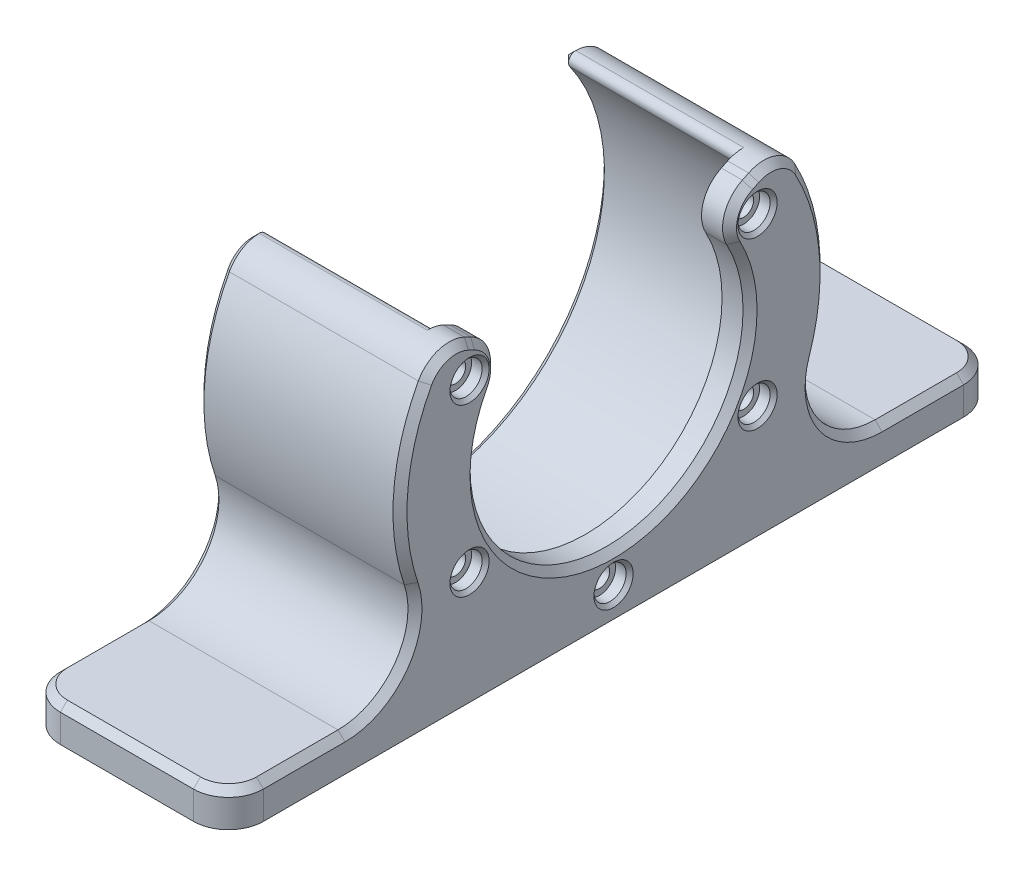
from build123d import *

# Parameters (mm, degrees)
SKETCH1_R           = 1.45
BOSS_EXTRUDE1_DEPTH = 29
FILLET1_R           = 10
FILLET2_R           = 5
SKETCH2_R           = 26.7
CUT_EXTRUDE1_DEPTH  = 25
FILLET3_R           = 1
FILLET4_R           = 5
SKETCH3_R           = 2.3
CUT_EXTRUDE2_DEPTH  = 2
CHAMFER2_SIZE       = 0.5


with BuildPart() as part:
    # Sketch1 → Boss-Extrude1 (new body)
    with BuildSketch(Plane(origin=(0, 0, 0), x_dir=(0, 0, -1), z_dir=(1, 0, 0))):
        with BuildLine():
            Line((55, 0), (-55, 0))
            Line((-55, 0), (-55, 5))
            Line((-55, 5), (-20.031225624, 5))
            ThreePointArc((-20.031225624, 5), (-30.341828635, 24.897833805), (-24.271193132, 46.470494957))
            Line((-24.271193132, 46.470494957), (-14.03683849, 41.535773536))
            ThreePointArc((-14.03683849, 41.535773536), (0, 8.5), (14.03683849, 41.535773536))
            Line((14.03683849, 41.535773536), (24.271193132, 46.470494957))
            ThreePointArc((24.271193132, 46.470494957), (30.341828635, 24.897833805), (20.031225624, 5))
            Line((20.031225624, 5), (55, 5))
            Line((55, 5), (55, 0))
        make_face()
        with Locations(Location((-20.56810334, 16.125, 0), (0, 0, 180))):
            Circle(SKETCH1_R, mode=Mode.SUBTRACT)
        with Locations(Location((20.56810334, 16.125, 0), (0, 0, 180))):
            Circle(SKETCH1_R, mode=Mode.SUBTRACT)
        with Locations(Location((0, 4.25, 0), (0, 0, 180))):
            Circle(SKETCH1_R, mode=Mode.SUBTRACT)
        with Locations(Location((-20.56810334, 39.875, 0), (0, 0, 180))):
            Circle(SKETCH1_R, mode=Mode.SUBTRACT)
        with Locations(Location((20.56810334, 39.875, 0), (0, 0, 180))):
            Circle(SKETCH1_R, mode=Mode.SUBTRACT)
    extrude(amount=BOSS_EXTRUDE1_DEPTH)

    # Fillet1
    fillet1_edges = [part.edges().sort_by_distance(p)[0] for p in [
        (14.5, 5, 20.031225624),
        (14.5, 5, -20.031225624),
    ]]
    fillet(fillet1_edges, radius=FILLET1_R)

    # Fillet2
    fillet2_edges = [part.edges().sort_by_distance(p)[0] for p in [
        (14.5, 46.470494957, 24.271193132),
        (14.5, 41.535773536, 14.03683849),
        (14.5, 41.535773536, -14.03683849),
        (14.5, 46.470494957, -24.271193132),
    ]]
    fillet(fillet2_edges, radius=FILLET2_R)

    # Sketch2 → Cut-Extrude1 (cut)
    with BuildSketch(Plane(origin=(0, 0, 0), x_dir=(0, 0, -1), z_dir=(1, 0, 0))):
        with Locations((0, 28)):
            Circle(SKETCH2_R)
    extrude(amount=CUT_EXTRUDE1_DEPTH, mode=Mode.SUBTRACT)

    # Fillet3
    fillet3_edges = [part.edges().sort_by_distance(p)[0] for p in [
        (12.5, 44.758999735, -20.785233409),
        (12.5, 44.758999735, 20.785233409),
    ]]
    fillet(fillet3_edges, radius=FILLET3_R)

    # Fillet4
    fillet4_edges = [part.edges().sort_by_distance(p)[0] for p in [
        (29, 2.5, -55),
        (0, 2.5, -55),
        (0, 2.5, 55),
        (29, 2.5, 55),
    ]]
    fillet(fillet4_edges, radius=FILLET4_R)

    # Sketch3 → Cut-Extrude2 (cut)
    with BuildSketch(Plane(origin=(29, 0, 0), x_dir=(0, 0, -1), z_dir=(1, 0, 0))):
        with Locations((-20.56810334, 39.875)):
            Circle(SKETCH3_R)
        with Locations((-20.56810334, 16.125)):
            Circle(SKETCH3_R)
        with Locations((0, 4.25)):
            Circle(SKETCH3_R)
        with Locations((20.56810334, 16.125)):
            Circle(SKETCH3_R)
        with Locations((20.56810334, 39.875)):
            Circle(SKETCH3_R)
    extrude(amount=-CUT_EXTRUDE2_DEPTH, mode=Mode.SUBTRACT)

    # Chamfer1
    # the kernel refuses this chamfer: 1 mm, written as the material it takes off along each edge
    with BuildSketch(Plane(origin=(0, 28, 0), x_dir=(0, 0.5794515273232917, 0.815006703949547), z_dir=(0, 0.815006703949547, -0.5794515273232917))) as chamfer1_piece_1:
        with BuildLine():
            Line((27.728284271, -0.028284271), (26.671715729, 1.028284271))
            Line((26.671715729, 1.028284271), (26.651715729, 1.028284271))
            ThreePointArc((26.651715729, 1.028284271), (26.68, 0.514142136), (26.68, 0))
            Line((26.68, 0), (26.7, -0.02))
            ThreePointArc((26.7, -0.02), (27.214142136, -0.02), (27.728284271, -0.048284271))
            Line((27.728284271, -0.048284271), (27.728284271, -0.028284271))
        make_face()
    revolve(axis=Axis((0, 28, 0), (1, 0, 0)), revolution_arc=250.823950469, mode=Mode.SUBTRACT)
    with BuildSketch(Plane(origin=(0, 40.052148529, -22.472109732), x_dir=(0, 0.4726332756600554, -0.8812592051938215), z_dir=(0, -0.8812592051938215, -0.4726332756600554))) as chamfer1_piece_2:
        with BuildLine():
            Line((3.971715729, -0.028284271), (5.028284271, 1.028284271))
            Line((5.028284271, 1.028284271), (5.048284271, 1.028284271))
            ThreePointArc((5.048284271, 1.028284271), (5.02, 0.514142136), (5.02, 0))
            Line((5.02, 0), (5, -0.02))
            ThreePointArc((5, -0.02), (4.485857864, -0.02), (3.971715729, -0.048284271))
            Line((3.971715729, -0.048284271), (3.971715729, -0.028284271))
        make_face()
    revolve(axis=Axis((0, 40.052148529, -22.472109732), (1, 0, 0)), revolution_arc=60.310853344, mode=Mode.SUBTRACT)
    with BuildSketch(Plane(origin=(0, 44.050807316, -22.575685682), x_dir=(0, -0.5794515416446061, 0.8150066937674127), z_dir=(0, -0.8150066937674127, -0.5794515416446061))) as chamfer1_piece_3:
        with BuildLine():
            Line((0, -9e-09), (1.028284251, -1.028284271))
            Line((1.028284251, -1.028284271), (1.048284251, -1.028284271))
            ThreePointArc((1.048284251, -1.028284271), (1.01999998, -0.514142136), (1.019999991, 0))
            Line((1.019999991, 0), (0.999999991, 0.02))
            Line((0.999999991, 0.02), (0, 0.047506276))
            Line((0, 0.047506276), (0, -9e-09))
        make_face()
    revolve(axis=Axis((0, 44.050807316, -22.575685682), (-1, 0, 0)), revolution_arc=126.895759533, mode=Mode.SUBTRACT)
    with BuildSketch(Plane(origin=(0, 44.050807316, 22.575685682), x_dir=(0, -0.5794515416446213, -0.815006693767402), z_dir=(0, -0.815006693767402, 0.5794515416446213))) as chamfer1_piece_4:
        with BuildLine():
            Line((0, 9e-09), (1.028284251, 1.028284271))
            Line((1.028284251, 1.028284271), (1.048284251, 1.028284271))
            ThreePointArc((1.048284251, 1.028284271), (1.01999998, 0.514142136), (1.019999991, 0))
            Line((1.019999991, 0), (0.999999991, -0.02))
            Line((0.999999991, -0.02), (0, -0.047506276))
            Line((0, -0.047506276), (0, 9e-09))
        make_face()
    revolve(axis=Axis((0, 44.050807316, 22.575685682), (1, 0, 0)), revolution_arc=126.895759533, mode=Mode.SUBTRACT)
    with BuildSketch(Plane(origin=(5, 5, -55), x_dir=(0, 0, 1), z_dir=(1, 0, 0))) as chamfer1_piece_5:
        with BuildLine():
            Line((1.028284271, -0.028284271), (-0.028284271, 1.028284271))
            Line((-0.028284271, 1.028284271), (-0.048284271, 1.028284271))
            ThreePointArc((-0.048284271, 1.028284271), (-0.02, 0.514142136), (-0.02, 0))
            Line((-0.02, 0), (0, -0.02))
            ThreePointArc((0, -0.02), (0.514142136, -0.02), (1.028284271, -0.048284271))
            Line((1.028284271, -0.048284271), (1.028284271, -0.028284271))
        make_face()
    extrude(amount=19, mode=Mode.SUBTRACT)
    with BuildSketch(Plane(origin=(0, 5, -38.356876828), x_dir=(0, -1, 0), z_dir=(0, 0, -1)), Plane(origin=(29, 5, -38.356876828), x_dir=(-1, 0, 0), z_dir=(0, 0, -1)), Plane(origin=(0, 5, 50), x_dir=(0, -1, 0), z_dir=(0, 0, -1)), Plane(origin=(29, 5, 50), x_dir=(-1, 0, 0), z_dir=(0, 0, -1))) as chamfer1_piece_6:
        with BuildLine():
            Line((1.028284271, 0.028284271), (-0.028284271, -1.028284271))
            Line((-0.028284271, -1.028284271), (-0.048284271, -1.028284271))
            ThreePointArc((-0.048284271, -1.028284271), (-0.02, -0.514142136), (-0.02, 0))
            Line((-0.02, 0), (0, 0.02))
            ThreePointArc((0, 0.02), (0.514142136, 0.02), (1.028284271, 0.048284271))
            Line((1.028284271, 0.048284271), (1.028284271, 0.028284271))
        make_face()
    extrude(amount=11.643123172, mode=Mode.SUBTRACT)
    with BuildSketch(Plane(origin=(24, 5, -50), x_dir=(1, 0, 0), z_dir=(0, 0, 1))) as chamfer1_piece_7:
        with BuildLine():
            Line((3.971715729, 0.028284271), (5.028284271, -1.028284271))
            Line((5.028284271, -1.028284271), (5.048284271, -1.028284271))
            ThreePointArc((5.048284271, -1.028284271), (5.02, -0.514142136), (5.02, 0))
            Line((5.02, 0), (5, 0.02))
            ThreePointArc((5, 0.02), (4.485857864, 0.02), (3.971715729, 0.048284271))
            Line((3.971715729, 0.048284271), (3.971715729, 0.028284271))
        make_face()
    revolve(axis=Axis((24, 5, -50), (0, 1, 0)), revolution_arc=90, mode=Mode.SUBTRACT)
    with BuildSketch(Plane(origin=(5, 5, -50), x_dir=(-1, 0, 0), z_dir=(0, 0, 1))) as chamfer1_piece_8:
        with BuildLine():
            Line((3.971715729, -0.028284271), (5.028284271, 1.028284271))
            Line((5.028284271, 1.028284271), (5.048284271, 1.028284271))
            ThreePointArc((5.048284271, 1.028284271), (5.02, 0.514142136), (5.02, 0))
            Line((5.02, 0), (5, -0.02))
            ThreePointArc((5, -0.02), (4.485857864, -0.02), (3.971715729, -0.048284271))
            Line((3.971715729, -0.048284271), (3.971715729, -0.028284271))
        make_face()
    revolve(axis=Axis((5, 5, -50), (0, -1, 0)), revolution_arc=90, mode=Mode.SUBTRACT)
    with BuildSketch(Plane(origin=(5, 5, 55), x_dir=(0, 0, -1), z_dir=(1, 0, 0))) as chamfer1_piece_9:
        with BuildLine():
            Line((1.028284271, 0.028284271), (-0.028284271, -1.028284271))
            Line((-0.028284271, -1.028284271), (-0.048284271, -1.028284271))
            ThreePointArc((-0.048284271, -1.028284271), (-0.02, -0.514142136), (-0.02, 0))
            Line((-0.02, 0), (0, 0.02))
            ThreePointArc((0, 0.02), (0.514142136, 0.02), (1.028284271, 0.048284271))
            Line((1.028284271, 0.048284271), (1.028284271, 0.028284271))
        make_face()
    extrude(amount=19, mode=Mode.SUBTRACT)
    with BuildSketch(Plane(origin=(24, 5, 50), x_dir=(1, 0, 0), z_dir=(0, 0, -1))) as chamfer1_piece_10:
        with BuildLine():
            Line((3.971715729, -0.028284271), (5.028284271, 1.028284271))
            Line((5.028284271, 1.028284271), (5.048284271, 1.028284271))
            ThreePointArc((5.048284271, 1.028284271), (5.02, 0.514142136), (5.02, 0))
            Line((5.02, 0), (5, -0.02))
            ThreePointArc((5, -0.02), (4.485857864, -0.02), (3.971715729, -0.048284271))
            Line((3.971715729, -0.048284271), (3.971715729, -0.028284271))
        make_face()
    revolve(axis=Axis((24, 5, 50), (0, -1, 0)), revolution_arc=90, mode=Mode.SUBTRACT)
    with BuildSketch(Plane(origin=(5, 5, 50), x_dir=(-1, 0, 0), z_dir=(0, 0, -1))) as chamfer1_piece_11:
        with BuildLine():
            Line((5.028284271, -1.028284271), (3.971715729, 0.028284271))
            Line((3.971715729, 0.028284271), (3.971715729, 0.048284271))
            ThreePointArc((3.971715729, 0.048284271), (4.485857864, 0.02), (5, 0.02))
            Line((5, 0.02), (5.02, 0))
            ThreePointArc((5.02, 0), (5.02, -0.514142136), (5.048284271, -1.028284271))
            Line((5.048284271, -1.028284271), (5.028284271, -1.028284271))
        make_face()
    revolve(axis=Axis((5, 5, 50), (0, 1, 0)), revolution_arc=90, mode=Mode.SUBTRACT)
    with BuildSketch(Plane(origin=(0, 28, 0), x_dir=(0, 0.4726332756600534, -0.8812592051938226), z_dir=(0, 0.8812592051938226, 0.4726332756600534))) as chamfer1_piece_12:
        with BuildLine():
            Line((29.471715729, 0.028284271), (30.528284271, -1.028284271))
            Line((30.528284271, -1.028284271), (30.548284271, -1.028284271))
            ThreePointArc((30.548284271, -1.028284271), (30.52, -0.514142136), (30.52, 0))
            Line((30.52, 0), (30.5, 0.02))
            ThreePointArc((30.5, 0.02), (29.985857864, 0.02), (29.471715729, 0.048284271))
            Line((29.471715729, 0.048284271), (29.471715729, 0.028284271))
        make_face()
    revolve(axis=Axis((0, 28, 0), (-1, 0, 0)), revolution_arc=46.928028915, mode=Mode.SUBTRACT)
    with BuildSketch(Plane(origin=(29, 28, 0), x_dir=(0, 0.4726332756600534, -0.8812592051938226), z_dir=(0, 0.8812592051938226, 0.4726332756600534))) as chamfer1_piece_13:
        with BuildLine():
            Line((30.528284271, 1.028284271), (29.471715729, -0.028284271))
            Line((29.471715729, -0.028284271), (29.471715729, -0.048284271))
            ThreePointArc((29.471715729, -0.048284271), (29.985857864, -0.02), (30.5, -0.02))
            Line((30.5, -0.02), (30.52, 0))
            ThreePointArc((30.52, 0), (30.52, 0.514142136), (30.548284271, 1.028284271))
            Line((30.548284271, 1.028284271), (30.528284271, 1.028284271))
        make_face()
    revolve(axis=Axis((29, 28, 0), (-1, 0, 0)), revolution_arc=46.928028915, mode=Mode.SUBTRACT)
    with BuildSketch(Plane(origin=(0, 15, 38.356876828), x_dir=(0, -1, 0), z_dir=(0, 0, 1))) as chamfer1_piece_14:
        with BuildLine():
            Line((11.028284271, -0.028284271), (9.971715729, 1.028284271))
            Line((9.971715729, 1.028284271), (9.951715729, 1.028284271))
            ThreePointArc((9.951715729, 1.028284271), (9.98, 0.514142136), (9.98, 0))
            Line((9.98, 0), (10, -0.02))
            ThreePointArc((10, -0.02), (10.514142136, -0.02), (11.028284271, -0.048284271))
            Line((11.028284271, -0.048284271), (11.028284271, -0.028284271))
        make_face()
    revolve(axis=Axis((0, 15, 38.356876828), (1, 0, 0)), revolution_arc=108.722664544, mode=Mode.SUBTRACT)
    with BuildSketch(Plane(origin=(29, 15, 38.356876828), x_dir=(0, -1, 0), z_dir=(0, 0, 1))) as chamfer1_piece_15:
        with BuildLine():
            Line((9.971715729, -1.028284271), (11.028284271, 0.028284271))
            Line((11.028284271, 0.028284271), (11.028284271, 0.048284271))
            ThreePointArc((11.028284271, 0.048284271), (10.514142136, 0.02), (10, 0.02))
            Line((10, 0.02), (9.98, 0))
            ThreePointArc((9.98, 0), (9.98, -0.514142136), (9.951715729, -1.028284271))
            Line((9.951715729, -1.028284271), (9.971715729, -1.028284271))
        make_face()
    revolve(axis=Axis((29, 15, 38.356876828), (1, 0, 0)), revolution_arc=108.722664544, mode=Mode.SUBTRACT)
    with BuildSketch(Plane(origin=(0, 15, -38.356876828), x_dir=(0, -1, 0), z_dir=(0, 0, -1))) as chamfer1_piece_16:
        with BuildLine():
            Line((11.028284271, 0.028284271), (9.971715729, -1.028284271))
            Line((9.971715729, -1.028284271), (9.951715729, -1.028284271))
            ThreePointArc((9.951715729, -1.028284271), (9.98, -0.514142136), (9.98, 0))
            Line((9.98, 0), (10, 0.02))
            ThreePointArc((10, 0.02), (10.514142136, 0.02), (11.028284271, 0.048284271))
            Line((11.028284271, 0.048284271), (11.028284271, 0.028284271))
        make_face()
    revolve(axis=Axis((0, 15, -38.356876828), (-1, 0, 0)), revolution_arc=108.722664544, mode=Mode.SUBTRACT)
    with BuildSketch(Plane(origin=(29, 15, -38.356876828), x_dir=(0, -1, 0), z_dir=(0, 0, -1))) as chamfer1_piece_17:
        with BuildLine():
            Line((9.971715729, 1.028284271), (11.028284271, -0.028284271))
            Line((11.028284271, -0.028284271), (11.028284271, -0.048284271))
            ThreePointArc((11.028284271, -0.048284271), (10.514142136, -0.02), (10, -0.02))
            Line((10, -0.02), (9.98, 0))
            ThreePointArc((9.98, 0), (9.98, 0.514142136), (9.951715729, 1.028284271))
            Line((9.951715729, 1.028284271), (9.971715729, 1.028284271))
        make_face()
    revolve(axis=Axis((29, 15, -38.356876828), (-1, 0, 0)), revolution_arc=108.722664544, mode=Mode.SUBTRACT)
    with BuildSketch(Plane(origin=(29, 44.121201454, -19.398881036), x_dir=(0, -0.9007583368811826, -0.4343206402406476), z_dir=(0, 0.4343206402406476, -0.9007583368811826)), Plane(origin=(29, 44.555940214, 20.300506531), x_dir=(0, -0.9007583368811826, 0.4343206402406476), z_dir=(0, -0.4343206402406476, -0.9007583368811826))) as chamfer1_piece_18:
        with BuildLine():
            Line((1.028284271, -0.028284271), (-0.028284271, 1.028284271))
            Line((-0.028284271, 1.028284271), (-0.048284271, 1.028284271))
            ThreePointArc((-0.048284271, 1.028284271), (-0.02, 0.514142136), (-0.02, 0))
            Line((-0.02, 0), (0, -0.02))
            ThreePointArc((0, -0.02), (0.514142136, -0.02), (1.028284271, -0.048284271))
            Line((1.028284271, -0.048284271), (1.028284271, -0.028284271))
        make_face()
    extrude(amount=1.000962698, mode=Mode.SUBTRACT)
    with BuildSketch(Plane(origin=(0, 28, 0), x_dir=(0, -0.3209876543209878, 0.9470833784696626), z_dir=(0, -0.9470833784696626, -0.3209876543209878))) as chamfer1_piece_19:
        with BuildLine():
            Line((29.471715729, 0.028284271), (30.528284271, -1.028284271))
            Line((30.528284271, -1.028284271), (30.548284271, -1.028284271))
            ThreePointArc((30.548284271, -1.028284271), (30.52, -0.514142136), (30.52, 0))
            Line((30.52, 0), (30.5, 0.02))
            ThreePointArc((30.5, 0.02), (29.985857864, 0.02), (29.471715729, 0.048284271))
            Line((29.471715729, 0.048284271), (29.471715729, 0.028284271))
        make_face()
    revolve(axis=Axis((0, 28, 0), (-1, 0, 0)), revolution_arc=46.928028915, mode=Mode.SUBTRACT)
    with BuildSketch(Plane(origin=(0, 40.052148529, 22.472109732), x_dir=(0, 0.9996646943809555, 0.02589399173999497), z_dir=(0, 0.02589399173999497, -0.9996646943809555))) as chamfer1_piece_20:
        with BuildLine():
            Line((3.971715729, -0.028284271), (5.028284271, 1.028284271))
            Line((5.028284271, 1.028284271), (5.048284271, 1.028284271))
            ThreePointArc((5.048284271, 1.028284271), (5.02, 0.514142136), (5.02, 0))
            Line((5.02, 0), (5, -0.02))
            ThreePointArc((5, -0.02), (4.485857864, -0.02), (3.971715729, -0.048284271))
            Line((3.971715729, -0.048284271), (3.971715729, -0.028284271))
        make_face()
    revolve(axis=Axis((0, 40.052148529, 22.472109732), (1, 0, 0)), revolution_arc=60.310853344, mode=Mode.SUBTRACT)
    with BuildSketch(Plane(origin=(29, 28, 0), x_dir=(0, 0.47417999059673505, 0.8804279280654836), z_dir=(0, 0.8804279280654836, -0.47417999059673505))) as chamfer1_piece_21:
        with BuildLine():
            Line((20.528284271, 0.028284271), (19.471715729, -1.028284271))
            Line((19.471715729, -1.028284271), (19.451715729, -1.028284271))
            ThreePointArc((19.451715729, -1.028284271), (19.48, -0.514142136), (19.48, 0))
            Line((19.48, 0), (19.5, 0.02))
            ThreePointArc((19.5, 0.02), (20.014142136, 0.02), (20.528284271, 0.048284271))
            Line((20.528284271, 0.048284271), (20.528284271, 0.028284271))
        make_face()
    revolve(axis=Axis((29, 28, 0), (1, 0, 0)), revolution_arc=236.611945436, mode=Mode.SUBTRACT)
    with BuildSketch(Plane(origin=(29, 28, 0), x_dir=(0, -0.3209876543209878, 0.9470833784696626), z_dir=(0, -0.9470833784696626, -0.3209876543209878))) as chamfer1_piece_22:
        with BuildLine():
            Line((30.528284271, 1.028284271), (29.471715729, -0.028284271))
            Line((29.471715729, -0.028284271), (29.471715729, -0.048284271))
            ThreePointArc((29.471715729, -0.048284271), (29.985857864, -0.02), (30.5, -0.02))
            Line((30.5, -0.02), (30.52, 0))
            ThreePointArc((30.52, 0), (30.52, 0.514142136), (30.548284271, 1.028284271))
            Line((30.548284271, 1.028284271), (30.528284271, 1.028284271))
        make_face()
    revolve(axis=Axis((29, 28, 0), (-1, 0, 0)), revolution_arc=46.928028915, mode=Mode.SUBTRACT)
    with BuildSketch(Plane(origin=(29, 39.61740977, 21.570484238), x_dir=(0, -0.4741799905967355, -0.8804279280654832), z_dir=(0, -0.8804279280654832, 0.4741799905967355))) as chamfer1_piece_23:
        with BuildLine():
            Line((3.971715729, 0.028284271), (5.028284271, -1.028284271))
            Line((5.028284271, -1.028284271), (5.048284271, -1.028284271))
            ThreePointArc((5.048284271, -1.028284271), (5.02, -0.514142136), (5.02, 0))
            Line((5.02, 0), (5, 0.02))
            ThreePointArc((5, 0.02), (4.485857864, 0.02), (3.971715729, 0.048284271))
            Line((3.971715729, 0.048284271), (3.971715729, 0.028284271))
        make_face()
    revolve(axis=Axis((29, 39.61740977, 21.570484238), (1, 0, 0)), revolution_arc=92.563899679, mode=Mode.SUBTRACT)
    with BuildSketch(Plane(origin=(29, 40.052148529, 22.472109732), x_dir=(0, 0.9007583368811826, -0.4343206402406474), z_dir=(0, -0.4343206402406474, -0.9007583368811826))) as chamfer1_piece_24:
        with BuildLine():
            Line((5.028284271, -1.028284271), (3.971715729, 0.028284271))
            Line((3.971715729, 0.028284271), (3.971715729, 0.048284271))
            ThreePointArc((3.971715729, 0.048284271), (4.485857864, 0.02), (5, 0.02))
            Line((5, 0.02), (5.02, 0))
            ThreePointArc((5.02, 0), (5.02, -0.514142136), (5.048284271, -1.028284271))
            Line((5.048284271, -1.028284271), (5.028284271, -1.028284271))
        make_face()
    revolve(axis=Axis((29, 40.052148529, 22.472109732), (1, 0, 0)), revolution_arc=87.536708668, mode=Mode.SUBTRACT)
    with BuildSketch(Plane(origin=(29, 39.61740977, -21.570484238), x_dir=(0, 0.9007583368811823, 0.4343206402406481), z_dir=(0, 0.4343206402406481, -0.9007583368811823))) as chamfer1_piece_25:
        with BuildLine():
            Line((3.971715729, 0.028284271), (5.028284271, -1.028284271))
            Line((5.028284271, -1.028284271), (5.048284271, -1.028284271))
            ThreePointArc((5.048284271, -1.028284271), (5.02, -0.514142136), (5.02, 0))
            Line((5.02, 0), (5, 0.02))
            ThreePointArc((5, 0.02), (4.485857864, 0.02), (3.971715729, 0.048284271))
            Line((3.971715729, 0.048284271), (3.971715729, 0.028284271))
        make_face()
    revolve(axis=Axis((29, 39.61740977, -21.570484238), (1, 0, 0)), revolution_arc=92.563899679, mode=Mode.SUBTRACT)
    with BuildSketch(Plane(origin=(29, 40.052148529, -22.472109732), x_dir=(0, 0.4726332756600554, -0.8812592051938215), z_dir=(0, -0.8812592051938215, -0.4726332756600554))) as chamfer1_piece_26:
        with BuildLine():
            Line((5.028284271, -1.028284271), (3.971715729, 0.028284271))
            Line((3.971715729, 0.028284271), (3.971715729, 0.048284271))
            ThreePointArc((3.971715729, 0.048284271), (4.485857864, 0.02), (5, 0.02))
            Line((5, 0.02), (5.02, 0))
            ThreePointArc((5.02, 0), (5.02, -0.514142136), (5.048284271, -1.028284271))
            Line((5.048284271, -1.028284271), (5.028284271, -1.028284271))
        make_face()
    revolve(axis=Axis((29, 40.052148529, -22.472109732), (1, 0, 0)), revolution_arc=87.536708668, mode=Mode.SUBTRACT)

    # Chamfer2
    chamfer2_edges = [part.edges().sort_by_distance(p)[0] for p in [
        (29, 39.875, -18.26810334),
        (29, 16.125, -18.26810334),
        (29, 4.25, 2.3),
        (29, 16.125, 22.86810334),
        (29, 39.875, 22.86810334),
    ]]
    chamfer(chamfer2_edges, length=CHAMFER2_SIZE)


solid = part.part
